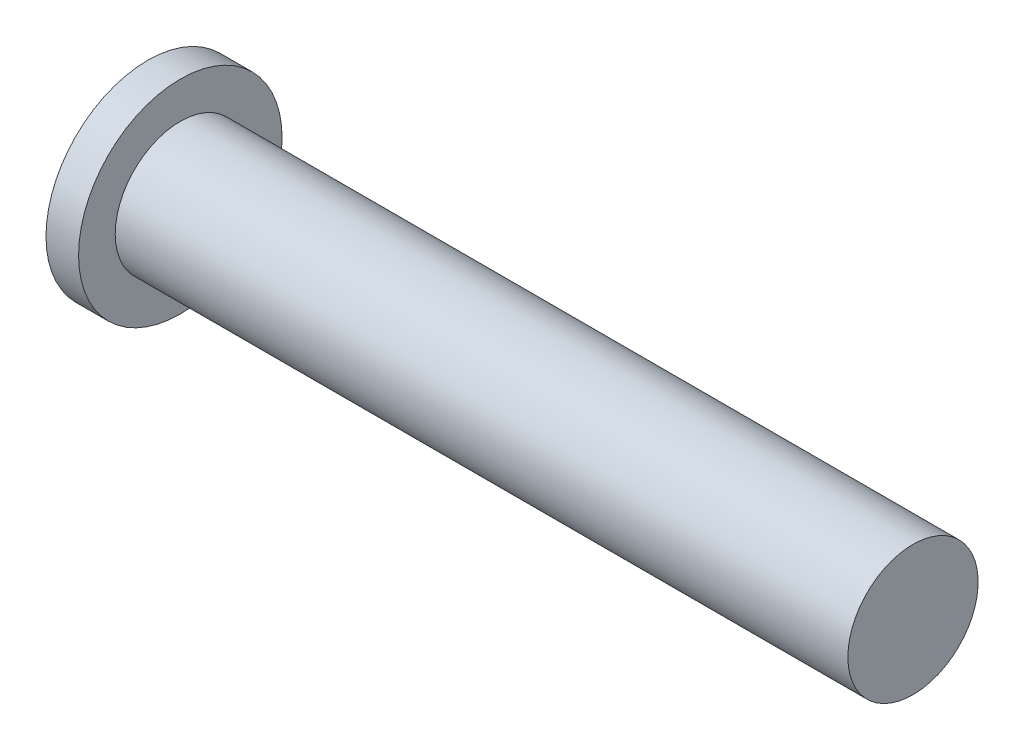
from build123d import *


with BuildPart() as part:
    # ｽｹｯﾁ1 → 回転1 (revolve)
    with BuildSketch(Plane(origin=(0, 0, 0), x_dir=(1, 0, 0), z_dir=(0, 1, 0))):
        Polygon((0, 0), (0, 6.25), (2, 6.25), (2, 4), (47, 4), (47, 0), align=None)
    revolve(axis=Axis((0, 0, 0), (1, 0, 0)))


solid = part.part
